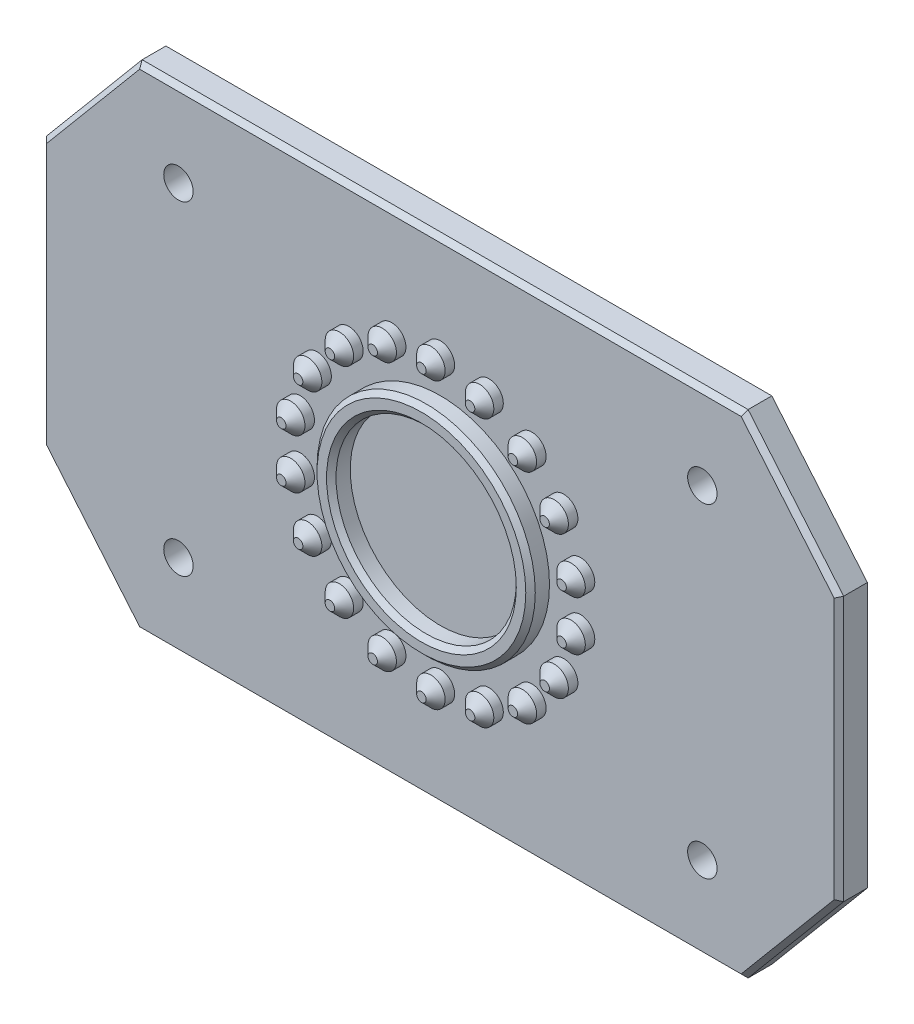
from build123d import *

# Parameters (mm, degrees)
BOSS_EXTRUDE1_DEPTH = 3
CHAMFER1_SIZE       = 0.5
CUT_EXTRUDE1_REACH  = 124.813
SKETCH2_R           = 1.55
SKETCH3_R           = 1.5
BOSS_EXTRUDE2_DEPTH = 2
CHAMFER2_SIZE       = 1
SKETCH4_R           = 11.5
SKETCH4_R_2         = 9.5
BOSS_EXTRUDE3_DEPTH = 2
CHAMFER3_SIZE       = 0.5


with BuildPart() as part:
    # Sketch1 → Boss-Extrude1 (new body)
    with BuildSketch(Plane.XY):
        Polygon((-110, 42.534332436), (-110, 14.650482688), (-99.930804426, 2.650482688), (-36.069195574, 2.650482688), (-26, 14.650482688), (-26, 42.534332436), (-36.069195574, 54.534332436), (-99.930804426, 54.534332436), align=None)
    extrude(amount=BOSS_EXTRUDE1_DEPTH)

    # Chamfer1
    chamfer1_edges = [part.edges().sort_by_distance(p)[0] for p in [
        (-110, 28.592407562, 3),
        (-104.965402213, 48.534332436, 3),
        (-68, 54.534332436, 3),
        (-31.034597787, 48.534332436, 3),
        (-26, 28.592407562, 3),
        (-31.034597787, 8.650482688, 3),
        (-68, 2.650482688, 3),
        (-104.965402213, 8.650482688, 3),
    ]]
    chamfer(chamfer1_edges, length=CHAMFER1_SIZE)

    # Sketch2 → Cut-Extrude1 (cut, up to next)
    with BuildSketch(Plane(origin=(0, 0, 0), x_dir=(-1, 0, 0), z_dir=(0, 0, -1)), mode=Mode.PRIVATE) as cut_extrude1_sk1:
        with Locations((40.392445123, 45.685066176)):
            Circle(SKETCH2_R)
    cut_extrude1_tool1 = extrude(cut_extrude1_sk1.sketch, amount=-CUT_EXTRUDE1_REACH, mode=Mode.PRIVATE) & part.part
    # Sketch2 → Cut-Extrude1 (cut, up to next)
    with BuildSketch(Plane(origin=(0, 0, 0), x_dir=(-1, 0, 0), z_dir=(0, 0, -1)), mode=Mode.PRIVATE) as cut_extrude1_sk2:
        with Locations((95.607554877, 45.685066176)):
            Circle(SKETCH2_R)
    cut_extrude1_tool2 = extrude(cut_extrude1_sk2.sketch, amount=-CUT_EXTRUDE1_REACH, mode=Mode.PRIVATE) & part.part
    # Sketch2 → Cut-Extrude1 (cut, up to next)
    with BuildSketch(Plane(origin=(0, 0, 0), x_dir=(-1, 0, 0), z_dir=(0, 0, -1)), mode=Mode.PRIVATE) as cut_extrude1_sk3:
        with Locations((95.607554877, 11.499748948)):
            Circle(SKETCH2_R)
    cut_extrude1_tool3 = extrude(cut_extrude1_sk3.sketch, amount=-CUT_EXTRUDE1_REACH, mode=Mode.PRIVATE) & part.part
    # Sketch2 → Cut-Extrude1 (cut, up to next)
    with BuildSketch(Plane(origin=(0, 0, 0), x_dir=(-1, 0, 0), z_dir=(0, 0, -1)), mode=Mode.PRIVATE) as cut_extrude1_sk4:
        with Locations((40.392445123, 11.499748948)):
            Circle(SKETCH2_R)
    cut_extrude1_tool4 = extrude(cut_extrude1_sk4.sketch, amount=-CUT_EXTRUDE1_REACH, mode=Mode.PRIVATE) & part.part
    add(cut_extrude1_tool1.solids().sort_by_distance((-40.392445, 45.685066, 0))[0], mode=Mode.SUBTRACT)
    add(cut_extrude1_tool2.solids().sort_by_distance((-95.607555, 45.685066, 0))[0], mode=Mode.SUBTRACT)
    add(cut_extrude1_tool3.solids().sort_by_distance((-95.607555, 11.499749, 0))[0], mode=Mode.SUBTRACT)
    add(cut_extrude1_tool4.solids().sort_by_distance((-40.392445, 11.499749, 0))[0], mode=Mode.SUBTRACT)

    # Sketch3 → Boss-Extrude2 (add)
    with BuildSketch(Plane.XY.offset(3)):
        with Locations((-68, 43.592407562)):
            Circle(SKETCH3_R)
        with Locations((-62.86969785, 42.687796874)):
            Circle(SKETCH3_R)
        with Locations((-58.358185855, 40.083074209)):
            Circle(SKETCH3_R)
        with Locations((-55.009618943, 36.092407562)):
            Circle(SKETCH3_R)
        with Locations((-53.227883705, 31.197130227)):
            Circle(SKETCH3_R)
        with Locations((-53.227883705, 25.987684897)):
            Circle(SKETCH3_R)
        with Locations((-55.009618943, 21.092407562)):
            Circle(SKETCH3_R)
        with Locations((-58.358185855, 17.101740915)):
            Circle(SKETCH3_R)
        with Locations((-62.86969785, 14.49701825)):
            Circle(SKETCH3_R)
        with Locations((-68, 13.592407562)):
            Circle(SKETCH3_R)
        with Locations((-73.13030215, 14.49701825)):
            Circle(SKETCH3_R)
        with Locations((-77.641814145, 17.101740915)):
            Circle(SKETCH3_R)
        with Locations((-80.990381057, 21.092407562)):
            Circle(SKETCH3_R)
        with Locations((-82.772116295, 25.987684897)):
            Circle(SKETCH3_R)
        with Locations((-82.772116295, 31.197130227)):
            Circle(SKETCH3_R)
        with Locations((-80.990381057, 36.092407562)):
            Circle(SKETCH3_R)
        with Locations((-77.641814145, 40.083074209)):
            Circle(SKETCH3_R)
        with Locations((-73.13030215, 42.687796874)):
            Circle(SKETCH3_R)
    extrude(amount=BOSS_EXTRUDE2_DEPTH)

    # Chamfer2
    chamfer2_edges = [part.edges().sort_by_distance(p)[0] for p in [
        (-69.5, 43.592407562, 5),
        (-82.490381057, 36.092407562, 5),
        (-84.272116295, 31.197130227, 5),
        (-84.272116295, 25.987684897, 5),
        (-82.490381057, 21.092407562, 5),
        (-79.141814145, 17.101740915, 5),
        (-74.63030215, 14.49701825, 5),
        (-69.5, 13.592407562, 5),
        (-64.36969785, 14.49701825, 5),
        (-59.858185855, 17.101740915, 5),
        (-56.509618943, 21.092407562, 5),
        (-54.727883705, 25.987684897, 5),
        (-54.727883705, 31.197130227, 5),
        (-56.509618943, 36.092407562, 5),
        (-59.858185855, 40.083074209, 5),
        (-64.36969785, 42.687796874, 5),
        (-74.63030215, 42.687796874, 5),
        (-79.141814145, 40.083074209, 5),
    ]]
    chamfer(chamfer2_edges, length=CHAMFER2_SIZE)

    # Sketch4 → Boss-Extrude3 (add)
    with BuildSketch(Plane.XY.offset(3)):
        with Locations((-68, 28.592407562)):
            Circle(SKETCH4_R)
        with Locations((-68, 28.592407562)):
            Circle(SKETCH4_R_2, mode=Mode.SUBTRACT)
    extrude(amount=BOSS_EXTRUDE3_DEPTH)

    # Chamfer3
    chamfer3_edges = [part.edges().sort_by_distance(p)[0] for p in [
        (-79.5, 28.592407562, 5),
        (-77.5, 28.592407562, 5),
    ]]
    chamfer(chamfer3_edges, length=CHAMFER3_SIZE)


solid = part.part
